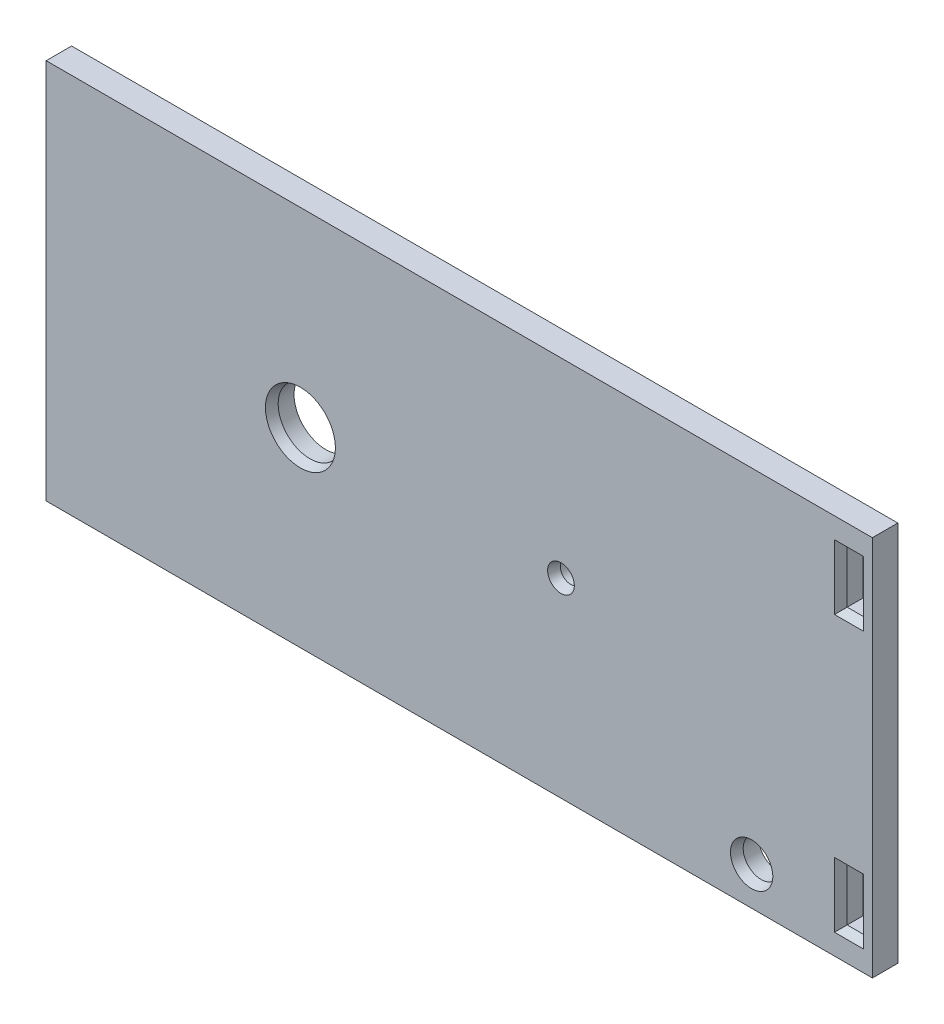
from build123d import *

# Parameters (mm, degrees)
SKETCH1_W           = 130
SKETCH1_H           = 60
SKETCH1_R           = 5
SKETCH1_R_2         = 2.83
SKETCH1_R_3         = 1.6
SKETCH1_W_2         = 3.53
SKETCH1_H_2         = 9.2
BOSS_EXTRUDE1_DEPTH = 2
CHAMFER1_SIZE       = 0.5
CHAMFER1_SIZE2      = 1.5


with BuildPart() as part:
    # Sketch1 → Boss-Extrude1 (new, symmetric)
    with BuildSketch(Plane.XY):
        Rectangle(SKETCH1_W, SKETCH1_H)
        with Locations((-25, 0)):
            Circle(SKETCH1_R, mode=Mode.SUBTRACT)
        with Locations((46, -24)):
            Circle(SKETCH1_R_2, mode=Mode.SUBTRACT)
        with Locations((16, 0)):
            Circle(SKETCH1_R_3, mode=Mode.SUBTRACT)
        with Locations((61.3, 21.65)):
            Rectangle(SKETCH1_W_2, SKETCH1_H_2, mode=Mode.SUBTRACT)
        with Locations((61.3, -21.65)):
            Rectangle(SKETCH1_W_2, SKETCH1_H_2, mode=Mode.SUBTRACT)
    extrude(amount=BOSS_EXTRUDE1_DEPTH, both=True)

    # Chamfer1
    chamfer1_edges = [part.edges().sort_by_distance(p)[0] for p in [
        (61.3, 17.05, 2),
        (59.535, 21.65, 2),
        (61.3, 26.25, 2),
        (63.065, 21.65, 2),
        (-30, 0, 2),
        (43.17, -24, 2),
        (61.3, -26.25, 2),
        (59.535, -21.65, 2),
        (61.3, -17.05, 2),
        (63.065, -21.65, 2),
        (14.4, 0, 2),
    ]]
    chamfer1_side = [part.faces().sort_by_distance(p)[0] for p in [
        (-0.433425409, 0.079211947, 2),
    ]]
    chamfer(chamfer1_edges, length=CHAMFER1_SIZE, length2=CHAMFER1_SIZE2, reference=chamfer1_side[0])


solid = part.part
